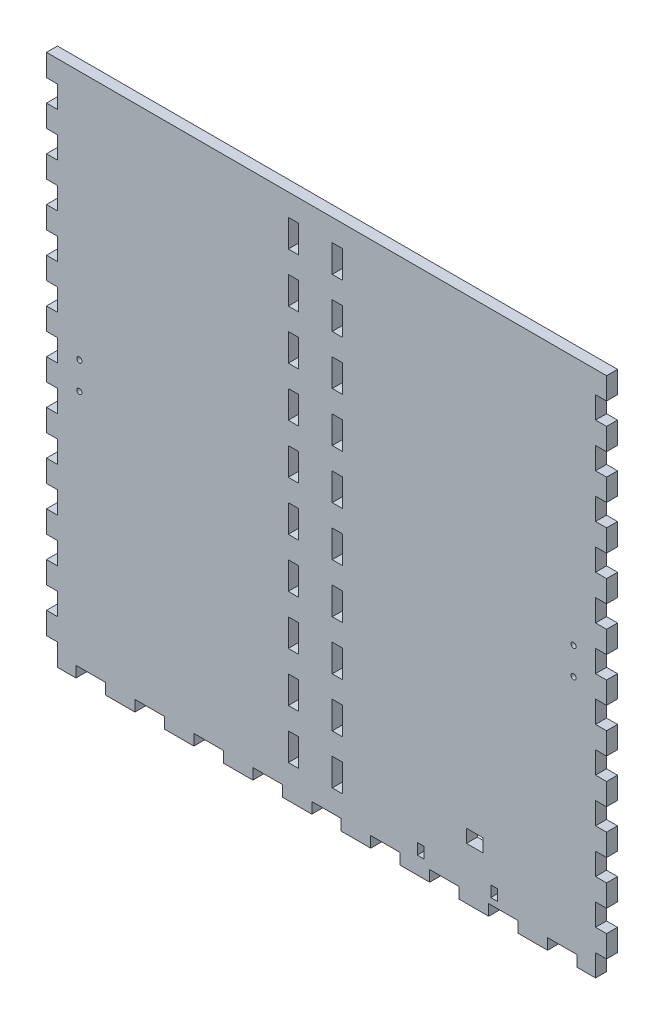
from build123d import *

# Parameters (mm, degrees)
SKETCH1_W              = 323.85
SKETCH1_H              = 139.7
BOSS_EXTRUDE1_DEPTH    = 6.35
SKETCH2_W              = 323.85
SKETCH2_H              = 139.7
SKETCH2_W_2            = 311.15
SKETCH2_H_2            = 127
BOSS_EXTRUDE2_DEPTH    = 298.45
SKETCH3_W              = 6.35
SKETCH3_H              = 16.933333333
SKETCH3_H_2            = 16.933333334
DOOR_SLOT_DEPTH        = 12.7
DOOR_GUIDE_HOLES_REACH = 372.007
SKETCH4_W              = 5.842
SKETCH4_H              = 15.875
LEVER_HOLES_R          = 1.5
LEVER_HOLES_W          = 9.652
LEVER_HOLES_H          = 7.62
LEVER_HOLES_W_2        = 3.999992
LEVER_HOLES_H_2        = 6.35
LEVERHOLE_CUT_DEPTH    = 373.342363457
CUT_EXTRUDE2_REACH     = 452.179
SKETCH7_R              = 3.175
SKETCH7_R_2            = 26.9875
CUT_EXTRUDE3_REACH     = 452.179
SKETCH8_R              = 3.175
SKETCH15_W             = 151.689001563
SKETCH15_H             = 328.434221774
CUT_EXTRUDE8_DEPTH     = 451.178725619
FRONT_BACK_W           = 6.35
FRONT_BACK_H           = 12.7
FRONT_BACK_W_2         = 17.044736842
FRONT_BACK_H_2         = 6.35
CUT_EXTRUDE9_DEPTH     = 373.342363457


with BuildPart() as part:
    # Sketch1 → Boss-Extrude1 (new body)
    with BuildSketch(Plane(origin=(0, 0, 0), x_dir=(1, 0, 0), z_dir=(0, 1, 0))):
        Rectangle(SKETCH1_W, SKETCH1_H)
    extrude(amount=BOSS_EXTRUDE1_DEPTH)

    # Sketch2 → Boss-Extrude2 (add)
    with BuildSketch(Plane(origin=(0, 6.35, 0), x_dir=(1, 0, 0), z_dir=(0, 1, 0))):
        Rectangle(SKETCH2_W, SKETCH2_H)
        Rectangle(SKETCH2_W_2, SKETCH2_H_2, mode=Mode.SUBTRACT)
    extrude(amount=BOSS_EXTRUDE2_DEPTH)

    # Sketch3 → Door Slot (cut)
    with BuildSketch(Plane.XY.offset(69.85)):
        with BuildLine():
            Line((-3.302, 283.21), (-3.302, 6.35))
            Line((-3.302, 6.35), (3.302, 6.35))
            Line((3.302, 6.35), (3.302, 292.354))
            Line((3.302, 292.354), (-16.256, 292.354))
            Line((-16.256, 292.354), (-16.256, 285.75))
            Line((-16.256, 285.75), (-5.842, 285.75))
            ThreePointArc((-5.842, 285.75), (-4.045948776, 285.006051224), (-3.302, 283.21))
        make_face()
        with Locations((12.827, 80.433333334)):
            Rectangle(SKETCH3_W, SKETCH3_H)
        with Locations((12.827, 50.8)):
            Rectangle(SKETCH3_W, SKETCH3_H_2)
        with Locations((12.827, 21.166666667)):
            Rectangle(SKETCH3_W, SKETCH3_H)
    extrude(amount=-DOOR_SLOT_DEPTH, mode=Mode.SUBTRACT)

    # Sketch4 → Door Guide Holes (cut, up to next)
    with BuildSketch(Plane.XY.offset(-63.5), mode=Mode.PRIVATE) as door_guide_holes_sk1:
        with Locations((-19.177, 284.1625)):
            Rectangle(SKETCH4_W, SKETCH4_H)
    door_guide_holes_tool1 = extrude(door_guide_holes_sk1.sketch, amount=-DOOR_GUIDE_HOLES_REACH, mode=Mode.PRIVATE) & part.part
    # Sketch4 → Door Guide Holes (cut, up to next)
    with BuildSketch(Plane.XY.offset(-63.5), mode=Mode.PRIVATE) as door_guide_holes_sk2:
        with Locations((-19.177, 255.5875)):
            Rectangle(SKETCH4_W, SKETCH4_H)
    door_guide_holes_tool2 = extrude(door_guide_holes_sk2.sketch, amount=-DOOR_GUIDE_HOLES_REACH, mode=Mode.PRIVATE) & part.part
    # Sketch4 → Door Guide Holes (cut, up to next)
    with BuildSketch(Plane.XY.offset(-63.5), mode=Mode.PRIVATE) as door_guide_holes_sk3:
        with Locations((-19.177, 227.0125)):
            Rectangle(SKETCH4_W, SKETCH4_H)
    door_guide_holes_tool3 = extrude(door_guide_holes_sk3.sketch, amount=-DOOR_GUIDE_HOLES_REACH, mode=Mode.PRIVATE) & part.part
    # Sketch4 → Door Guide Holes (cut, up to next)
    with BuildSketch(Plane.XY.offset(-63.5), mode=Mode.PRIVATE) as door_guide_holes_sk4:
        with Locations((-19.177, 198.4375)):
            Rectangle(SKETCH4_W, SKETCH4_H)
    door_guide_holes_tool4 = extrude(door_guide_holes_sk4.sketch, amount=-DOOR_GUIDE_HOLES_REACH, mode=Mode.PRIVATE) & part.part
    # Sketch4 → Door Guide Holes (cut, up to next)
    with BuildSketch(Plane.XY.offset(-63.5), mode=Mode.PRIVATE) as door_guide_holes_sk5:
        with Locations((-19.177, 169.8625)):
            Rectangle(SKETCH4_W, SKETCH4_H)
    door_guide_holes_tool5 = extrude(door_guide_holes_sk5.sketch, amount=-DOOR_GUIDE_HOLES_REACH, mode=Mode.PRIVATE) & part.part
    # Sketch4 → Door Guide Holes (cut, up to next)
    with BuildSketch(Plane.XY.offset(-63.5), mode=Mode.PRIVATE) as door_guide_holes_sk6:
        with Locations((-19.177, 141.2875)):
            Rectangle(SKETCH4_W, SKETCH4_H)
    door_guide_holes_tool6 = extrude(door_guide_holes_sk6.sketch, amount=-DOOR_GUIDE_HOLES_REACH, mode=Mode.PRIVATE) & part.part
    # Sketch4 → Door Guide Holes (cut, up to next)
    with BuildSketch(Plane.XY.offset(-63.5), mode=Mode.PRIVATE) as door_guide_holes_sk7:
        with Locations((-19.177, 112.7125)):
            Rectangle(SKETCH4_W, SKETCH4_H)
    door_guide_holes_tool7 = extrude(door_guide_holes_sk7.sketch, amount=-DOOR_GUIDE_HOLES_REACH, mode=Mode.PRIVATE) & part.part
    # Sketch4 → Door Guide Holes (cut, up to next)
    with BuildSketch(Plane.XY.offset(-63.5), mode=Mode.PRIVATE) as door_guide_holes_sk8:
        with Locations((-19.177, 84.1375)):
            Rectangle(SKETCH4_W, SKETCH4_H)
    door_guide_holes_tool8 = extrude(door_guide_holes_sk8.sketch, amount=-DOOR_GUIDE_HOLES_REACH, mode=Mode.PRIVATE) & part.part
    # Sketch4 → Door Guide Holes (cut, up to next)
    with BuildSketch(Plane.XY.offset(-63.5), mode=Mode.PRIVATE) as door_guide_holes_sk9:
        with Locations((-19.177, 55.5625)):
            Rectangle(SKETCH4_W, SKETCH4_H)
    door_guide_holes_tool9 = extrude(door_guide_holes_sk9.sketch, amount=-DOOR_GUIDE_HOLES_REACH, mode=Mode.PRIVATE) & part.part
    # Sketch4 → Door Guide Holes (cut, up to next)
    with BuildSketch(Plane.XY.offset(-63.5), mode=Mode.PRIVATE) as door_guide_holes_sk10:
        with Locations((-19.177, 26.9875)):
            Rectangle(SKETCH4_W, SKETCH4_H)
    door_guide_holes_tool10 = extrude(door_guide_holes_sk10.sketch, amount=-DOOR_GUIDE_HOLES_REACH, mode=Mode.PRIVATE) & part.part
    door_guide_holes_1 = door_guide_holes_tool1.solids().sort_by_distance((-19.177, 284.1625, -63.5))[0]
    add(door_guide_holes_1, mode=Mode.SUBTRACT)
    door_guide_holes_2 = door_guide_holes_tool2.solids().sort_by_distance((-19.177, 255.5875, -63.5))[0]
    add(door_guide_holes_2, mode=Mode.SUBTRACT)
    door_guide_holes_3 = door_guide_holes_tool3.solids().sort_by_distance((-19.177, 227.0125, -63.5))[0]
    add(door_guide_holes_3, mode=Mode.SUBTRACT)
    door_guide_holes_4 = door_guide_holes_tool4.solids().sort_by_distance((-19.177, 198.4375, -63.5))[0]
    add(door_guide_holes_4, mode=Mode.SUBTRACT)
    door_guide_holes_5 = door_guide_holes_tool5.solids().sort_by_distance((-19.177, 169.8625, -63.5))[0]
    add(door_guide_holes_5, mode=Mode.SUBTRACT)
    door_guide_holes_6 = door_guide_holes_tool6.solids().sort_by_distance((-19.177, 141.2875, -63.5))[0]
    add(door_guide_holes_6, mode=Mode.SUBTRACT)
    door_guide_holes_7 = door_guide_holes_tool7.solids().sort_by_distance((-19.177, 112.7125, -63.5))[0]
    add(door_guide_holes_7, mode=Mode.SUBTRACT)
    door_guide_holes_8 = door_guide_holes_tool8.solids().sort_by_distance((-19.177, 84.1375, -63.5))[0]
    add(door_guide_holes_8, mode=Mode.SUBTRACT)
    door_guide_holes_9 = door_guide_holes_tool9.solids().sort_by_distance((-19.177, 55.5625, -63.5))[0]
    add(door_guide_holes_9, mode=Mode.SUBTRACT)
    door_guide_holes_10 = door_guide_holes_tool10.solids().sort_by_distance((-19.177, 26.9875, -63.5))[0]
    add(door_guide_holes_10, mode=Mode.SUBTRACT)
    door_guide_holes = door_guide_holes_1 + door_guide_holes_2 + door_guide_holes_3 + door_guide_holes_4 + door_guide_holes_5 + door_guide_holes_6 + door_guide_holes_7 + door_guide_holes_8 + door_guide_holes_9 + door_guide_holes_10  # Door Guide Holes as one shape, for the pattern or mirror that repeats it

    # Mirror1: Door Guide Holes across plane
    add(door_guide_holes.mirror(Plane.ZY.offset(6.477)), mode=Mode.SUBTRACT)

    # Lever Holes → LeverHole Cut (cut, through all)
    with BuildSketch(Plane.XY.offset(69.85)):
        with Locations((-142.875, 160.275)):
            Circle(LEVER_HOLES_R)
        with Locations((-142.875, 144.525)):
            Circle(LEVER_HOLES_R)
        with Locations((142.875, 144.525)):
            Circle(LEVER_HOLES_R)
        with Locations((142.875, 160.275)):
            Circle(LEVER_HOLES_R)
        with Locations((85.725, 33.8749894)):
            Rectangle(LEVER_HOLES_W, LEVER_HOLES_H)
        with Locations((54.475012, 13.175)):
            Rectangle(LEVER_HOLES_W_2, LEVER_HOLES_H_2)
        with Locations((96.975004, 13.175)):
            Rectangle(LEVER_HOLES_W_2, LEVER_HOLES_H_2)
    extrude(amount=-LEVERHOLE_CUT_DEPTH, mode=Mode.SUBTRACT)

    # Sketch7 → Cut-Extrude2 (cut, up to next)
    with BuildSketch(Plane(origin=(161.925, 0, 0), x_dir=(0, 0, -1), z_dir=(1, 0, 0)), mode=Mode.PRIVATE) as cut_extrude2_sk1:
        with Locations((-37.211, 92.583)):
            Circle(SKETCH7_R)
    cut_extrude2_tool1 = extrude(cut_extrude2_sk1.sketch, amount=-CUT_EXTRUDE2_REACH, mode=Mode.PRIVATE) & part.part
    # Sketch7 → Cut-Extrude2 (cut, up to next)
    with BuildSketch(Plane(origin=(161.925, 0, 0), x_dir=(0, 0, -1), z_dir=(1, 0, 0)), mode=Mode.PRIVATE) as cut_extrude2_sk2:
        with Locations((37.211, 92.583)):
            Circle(SKETCH7_R)
    cut_extrude2_tool2 = extrude(cut_extrude2_sk2.sketch, amount=-CUT_EXTRUDE2_REACH, mode=Mode.PRIVATE) & part.part
    # Sketch7 → Cut-Extrude2 (cut, up to next)
    with BuildSketch(Plane(origin=(161.925, 0, 0), x_dir=(0, 0, -1), z_dir=(1, 0, 0)), mode=Mode.PRIVATE) as cut_extrude2_sk3:
        with Locations((-37.211, 18.161)):
            Circle(SKETCH7_R)
    cut_extrude2_tool3 = extrude(cut_extrude2_sk3.sketch, amount=-CUT_EXTRUDE2_REACH, mode=Mode.PRIVATE) & part.part
    # Sketch7 → Cut-Extrude2 (cut, up to next)
    with BuildSketch(Plane(origin=(161.925, 0, 0), x_dir=(0, 0, -1), z_dir=(1, 0, 0)), mode=Mode.PRIVATE) as cut_extrude2_sk4:
        with Locations((37.211, 18.161)):
            Circle(SKETCH7_R)
    cut_extrude2_tool4 = extrude(cut_extrude2_sk4.sketch, amount=-CUT_EXTRUDE2_REACH, mode=Mode.PRIVATE) & part.part
    # Sketch7 → Cut-Extrude2 (cut, up to next)
    with BuildSketch(Plane(origin=(161.925, 0, 0), x_dir=(0, 0, -1), z_dir=(1, 0, 0)), mode=Mode.PRIVATE) as cut_extrude2_sk5:
        with Locations((0, 55.372)):
            Circle(SKETCH7_R_2)
    cut_extrude2_tool5 = extrude(cut_extrude2_sk5.sketch, amount=-CUT_EXTRUDE2_REACH, mode=Mode.PRIVATE) & part.part
    add(cut_extrude2_tool1.solids().sort_by_distance((161.925, 92.583, 37.211))[0], mode=Mode.SUBTRACT)
    add(cut_extrude2_tool2.solids().sort_by_distance((161.925, 92.583, -37.211))[0], mode=Mode.SUBTRACT)
    add(cut_extrude2_tool3.solids().sort_by_distance((161.925, 18.161, 37.211))[0], mode=Mode.SUBTRACT)
    add(cut_extrude2_tool4.solids().sort_by_distance((161.925, 18.161, -37.211))[0], mode=Mode.SUBTRACT)
    add(cut_extrude2_tool5.solids().sort_by_distance((161.925, 55.372, 0))[0], mode=Mode.SUBTRACT)

    # Sketch8 → Cut-Extrude3 (cut, up to next)
    with BuildSketch(Plane.ZY.offset(161.925), mode=Mode.PRIVATE) as cut_extrude3_sk1:
        with Locations((0, 19.05)):
            Circle(SKETCH8_R)
    cut_extrude3_tool1 = extrude(cut_extrude3_sk1.sketch, amount=-CUT_EXTRUDE3_REACH, mode=Mode.PRIVATE) & part.part
    add(cut_extrude3_tool1.solids().sort_by_distance((-161.925, 19.05, 0))[0], mode=Mode.SUBTRACT)

    # Sketch15 → Cut-Extrude8 (cut, through all)
    with BuildSketch(Plane.ZY.offset(161.925)):
        with Locations((12.344500781, 140.582889113)):
            Rectangle(SKETCH15_W, SKETCH15_H)
    extrude(amount=-CUT_EXTRUDE8_DEPTH, mode=Mode.SUBTRACT)

    # Front/Back → Cut-Extrude9 (cut, through all)
    with BuildSketch(Plane.XY.offset(69.85)):
        with Locations((-158.75, 6.35)):
            Rectangle(FRONT_BACK_W, FRONT_BACK_H)
        with Locations((-136.357894737, 3.175)):
            Rectangle(FRONT_BACK_W_2, FRONT_BACK_H_2)
        with Locations((-158.75, 31.75)):
            Rectangle(FRONT_BACK_W, FRONT_BACK_H)
        with Locations((-102.268421053, 3.175)):
            Rectangle(FRONT_BACK_W_2, FRONT_BACK_H_2)
        with Locations((-158.75, 57.15)):
            Rectangle(FRONT_BACK_W, FRONT_BACK_H)
        with Locations((-68.178947368, 3.175)):
            Rectangle(FRONT_BACK_W_2, FRONT_BACK_H_2)
        with Locations((-158.75, 82.55)):
            Rectangle(FRONT_BACK_W, FRONT_BACK_H)
        with Locations((-34.089473684, 3.175)):
            Rectangle(FRONT_BACK_W_2, FRONT_BACK_H_2)
        with Locations((-158.75, 107.95)):
            Rectangle(FRONT_BACK_W, FRONT_BACK_H)
        with Locations((0, 3.175)):
            Rectangle(FRONT_BACK_W_2, FRONT_BACK_H_2)
        with Locations((-158.75, 133.35)):
            Rectangle(FRONT_BACK_W, FRONT_BACK_H)
        with Locations((34.089473684, 3.175)):
            Rectangle(FRONT_BACK_W_2, FRONT_BACK_H_2)
        with Locations((-158.75, 158.75)):
            Rectangle(FRONT_BACK_W, FRONT_BACK_H)
        with Locations((68.178947368, 3.175)):
            Rectangle(FRONT_BACK_W_2, FRONT_BACK_H_2)
        with Locations((-158.75, 184.15)):
            Rectangle(FRONT_BACK_W, FRONT_BACK_H)
        with Locations((102.268421053, 3.175)):
            Rectangle(FRONT_BACK_W_2, FRONT_BACK_H_2)
        with Locations((-158.75, 209.55)):
            Rectangle(FRONT_BACK_W, FRONT_BACK_H)
        with Locations((136.357894737, 3.175)):
            Rectangle(FRONT_BACK_W_2, FRONT_BACK_H_2)
        with Locations((-158.75, 234.95)):
            Rectangle(FRONT_BACK_W, FRONT_BACK_H)
        with Locations((158.75, 6.35)):
            Rectangle(FRONT_BACK_W, FRONT_BACK_H)
        with Locations((-158.75, 260.35)):
            Rectangle(FRONT_BACK_W, FRONT_BACK_H)
        with Locations((158.75, 31.75)):
            Rectangle(FRONT_BACK_W, FRONT_BACK_H)
        with Locations((-158.75, 285.75)):
            Rectangle(FRONT_BACK_W, FRONT_BACK_H)
        with Locations((158.75, 57.15)):
            Rectangle(FRONT_BACK_W, FRONT_BACK_H)
        with Locations((158.75, 82.55)):
            Rectangle(FRONT_BACK_W, FRONT_BACK_H)
        with Locations((158.75, 107.95)):
            Rectangle(FRONT_BACK_W, FRONT_BACK_H)
        with Locations((158.75, 133.35)):
            Rectangle(FRONT_BACK_W, FRONT_BACK_H)
        with Locations((158.75, 158.75)):
            Rectangle(FRONT_BACK_W, FRONT_BACK_H)
        with Locations((158.75, 184.15)):
            Rectangle(FRONT_BACK_W, FRONT_BACK_H)
        with Locations((158.75, 209.55)):
            Rectangle(FRONT_BACK_W, FRONT_BACK_H)
        with Locations((158.75, 234.95)):
            Rectangle(FRONT_BACK_W, FRONT_BACK_H)
        with Locations((158.75, 260.35)):
            Rectangle(FRONT_BACK_W, FRONT_BACK_H)
        with Locations((158.75, 285.75)):
            Rectangle(FRONT_BACK_W, FRONT_BACK_H)
    extrude(amount=-CUT_EXTRUDE9_DEPTH, mode=Mode.SUBTRACT)


solid = part.part
